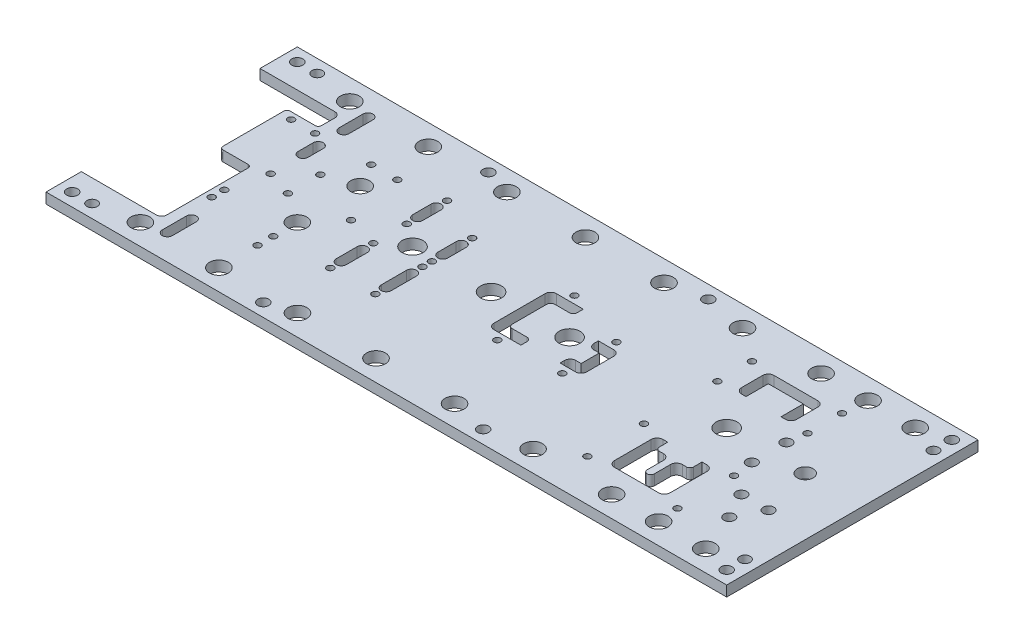
from build123d import *

# Parameters (mm, degrees)
SKETCH1_W                      = 650
SKETCH1_H                      = 240
BOSS_EXTRUDE1_DEPTH            = 10
CUT_EXTRUDE1_REACH             = 348.591
SKETCH2_R                      = 9
SKETCH2_R_2                    = 10
M6_CLEARANCE_HOLE1_D           = 6.4
M6_CLEARANCE_HOLE1_CSINK_D     = 6.45
M6_CLEARANCE_HOLE1_CSINK_ANGLE = 90
CUT_EXTRUDE2_REACH             = 348.591
FILLET1_R                      = 3
CUT_EXTRUDE3_REACH             = 348.591
SKETCH12_R                     = 5.113641914
SKETCH12_R_2                   = 7.613641914
CUT_EXTRUDE4_REACH             = 348.591
CUT_EXTRUDE5_REACH             = 348.591
CUT_EXTRUDE6_REACH             = 348.591
M10_CLEARANCE_HOLE1_D          = 10.5
F_10_0MM_DOWEL_HOLE1_D         = 10


with BuildPart() as part:
    # Sketch1 → Boss-Extrude1 (new body)
    with BuildSketch(Plane(origin=(0, 0, 0), x_dir=(1, 0, 0), z_dir=(0, 1, 0))):
        Rectangle(SKETCH1_W, SKETCH1_H)
    extrude(amount=-BOSS_EXTRUDE1_DEPTH)

    # Sketch2 → Cut-Extrude1 (cut, up to next)
    with BuildSketch(Plane.XZ.offset(10), mode=Mode.PRIVATE) as cut_extrude1_sk1:
        with Locations((-254.87, -100)):
            Circle(SKETCH2_R)
    cut_extrude1_tool1 = extrude(cut_extrude1_sk1.sketch, amount=-CUT_EXTRUDE1_REACH, mode=Mode.PRIVATE) & part.part
    # Sketch2 → Cut-Extrude1 (cut, up to next)
    with BuildSketch(Plane.XZ.offset(10), mode=Mode.PRIVATE) as cut_extrude1_sk2:
        with Locations((285, -100)):
            Circle(SKETCH2_R)
    cut_extrude1_tool2 = extrude(cut_extrude1_sk2.sketch, amount=-CUT_EXTRUDE1_REACH, mode=Mode.PRIVATE) & part.part
    # Sketch2 → Cut-Extrude1 (cut, up to next)
    with BuildSketch(Plane.XZ.offset(10), mode=Mode.PRIVATE) as cut_extrude1_sk3:
        with Locations((120.13, 100)):
            Circle(SKETCH2_R)
    cut_extrude1_tool3 = extrude(cut_extrude1_sk3.sketch, amount=-CUT_EXTRUDE1_REACH, mode=Mode.PRIVATE) & part.part
    # Sketch2 → Cut-Extrude1 (cut, up to next)
    with BuildSketch(Plane.XZ.offset(10), mode=Mode.PRIVATE) as cut_extrude1_sk4:
        with Locations((120.13, -100)):
            Circle(SKETCH2_R)
    cut_extrude1_tool4 = extrude(cut_extrude1_sk4.sketch, amount=-CUT_EXTRUDE1_REACH, mode=Mode.PRIVATE) & part.part
    # Sketch2 → Cut-Extrude1 (cut, up to next)
    with BuildSketch(Plane.XZ.offset(10), mode=Mode.PRIVATE) as cut_extrude1_sk5:
        with Locations((45.13, 100)):
            Circle(SKETCH2_R)
    cut_extrude1_tool5 = extrude(cut_extrude1_sk5.sketch, amount=-CUT_EXTRUDE1_REACH, mode=Mode.PRIVATE) & part.part
    # Sketch2 → Cut-Extrude1 (cut, up to next)
    with BuildSketch(Plane.XZ.offset(10), mode=Mode.PRIVATE) as cut_extrude1_sk6:
        with Locations((240, 100)):
            Circle(SKETCH2_R)
    cut_extrude1_tool6 = extrude(cut_extrude1_sk6.sketch, amount=-CUT_EXTRUDE1_REACH, mode=Mode.PRIVATE) & part.part
    # Sketch2 → Cut-Extrude1 (cut, up to next)
    with BuildSketch(Plane.XZ.offset(10), mode=Mode.PRIVATE) as cut_extrude1_sk7:
        with Locations((240, -100)):
            Circle(SKETCH2_R)
    cut_extrude1_tool7 = extrude(cut_extrude1_sk7.sketch, amount=-CUT_EXTRUDE1_REACH, mode=Mode.PRIVATE) & part.part
    # Sketch2 → Cut-Extrude1 (cut, up to next)
    with BuildSketch(Plane.XZ.offset(10), mode=Mode.PRIVATE) as cut_extrude1_sk8:
        with Locations((195.13, -100)):
            Circle(SKETCH2_R)
    cut_extrude1_tool8 = extrude(cut_extrude1_sk8.sketch, amount=-CUT_EXTRUDE1_REACH, mode=Mode.PRIVATE) & part.part
    # Sketch2 → Cut-Extrude1 (cut, up to next)
    with BuildSketch(Plane.XZ.offset(10), mode=Mode.PRIVATE) as cut_extrude1_sk9:
        with Locations((285, 100)):
            Circle(SKETCH2_R)
    cut_extrude1_tool9 = extrude(cut_extrude1_sk9.sketch, amount=-CUT_EXTRUDE1_REACH, mode=Mode.PRIVATE) & part.part
    # Sketch2 → Cut-Extrude1 (cut, up to next)
    with BuildSketch(Plane.XZ.offset(10), mode=Mode.PRIVATE) as cut_extrude1_sk10:
        with Locations((-104.87, -100)):
            Circle(SKETCH2_R)
    cut_extrude1_tool10 = extrude(cut_extrude1_sk10.sketch, amount=-CUT_EXTRUDE1_REACH, mode=Mode.PRIVATE) & part.part
    # Sketch2 → Cut-Extrude1 (cut, up to next)
    with BuildSketch(Plane.XZ.offset(10), mode=Mode.PRIVATE) as cut_extrude1_sk11:
        with Locations((-179.87, 100)):
            Circle(SKETCH2_R)
    cut_extrude1_tool11 = extrude(cut_extrude1_sk11.sketch, amount=-CUT_EXTRUDE1_REACH, mode=Mode.PRIVATE) & part.part
    # Sketch2 → Cut-Extrude1 (cut, up to next)
    with BuildSketch(Plane.XZ.offset(10), mode=Mode.PRIVATE) as cut_extrude1_sk12:
        with Locations((-179.87, -100)):
            Circle(SKETCH2_R)
    cut_extrude1_tool12 = extrude(cut_extrude1_sk12.sketch, amount=-CUT_EXTRUDE1_REACH, mode=Mode.PRIVATE) & part.part
    # Sketch2 → Cut-Extrude1 (cut, up to next)
    with BuildSketch(Plane.XZ.offset(10), mode=Mode.PRIVATE) as cut_extrude1_sk13:
        with Locations((45.13, -100)):
            Circle(SKETCH2_R)
    cut_extrude1_tool13 = extrude(cut_extrude1_sk13.sketch, amount=-CUT_EXTRUDE1_REACH, mode=Mode.PRIVATE) & part.part
    # Sketch2 → Cut-Extrude1 (cut, up to next)
    with BuildSketch(Plane.XZ.offset(10), mode=Mode.PRIVATE) as cut_extrude1_sk14:
        with Locations((-29.87, 100)):
            Circle(SKETCH2_R)
    cut_extrude1_tool14 = extrude(cut_extrude1_sk14.sketch, amount=-CUT_EXTRUDE1_REACH, mode=Mode.PRIVATE) & part.part
    # Sketch2 → Cut-Extrude1 (cut, up to next)
    with BuildSketch(Plane.XZ.offset(10), mode=Mode.PRIVATE) as cut_extrude1_sk15:
        with Locations((-29.87, -100)):
            Circle(SKETCH2_R)
    cut_extrude1_tool15 = extrude(cut_extrude1_sk15.sketch, amount=-CUT_EXTRUDE1_REACH, mode=Mode.PRIVATE) & part.part
    # Sketch2 → Cut-Extrude1 (cut, up to next)
    with BuildSketch(Plane.XZ.offset(10), mode=Mode.PRIVATE) as cut_extrude1_sk16:
        with Locations((-104.87, 100)):
            Circle(SKETCH2_R)
    cut_extrude1_tool16 = extrude(cut_extrude1_sk16.sketch, amount=-CUT_EXTRUDE1_REACH, mode=Mode.PRIVATE) & part.part
    # Sketch2 → Cut-Extrude1 (cut, up to next)
    with BuildSketch(Plane.XZ.offset(10), mode=Mode.PRIVATE) as cut_extrude1_sk17:
        with Locations((195.13, 100)):
            Circle(SKETCH2_R)
    cut_extrude1_tool17 = extrude(cut_extrude1_sk17.sketch, amount=-CUT_EXTRUDE1_REACH, mode=Mode.PRIVATE) & part.part
    # Sketch2 → Cut-Extrude1 (cut, up to next)
    with BuildSketch(Plane.XZ.offset(10), mode=Mode.PRIVATE) as cut_extrude1_sk18:
        with Locations((-254.87, 100)):
            Circle(SKETCH2_R)
    cut_extrude1_tool18 = extrude(cut_extrude1_sk18.sketch, amount=-CUT_EXTRUDE1_REACH, mode=Mode.PRIVATE) & part.part
    # Sketch2 → Cut-Extrude1 (cut, up to next)
    with BuildSketch(Plane.XZ.offset(10), mode=Mode.PRIVATE) as cut_extrude1_sk19:
        with Locations((195.13, -9.86)):
            Circle(SKETCH2_R_2)
    cut_extrude1_tool19 = extrude(cut_extrude1_sk19.sketch, amount=-CUT_EXTRUDE1_REACH, mode=Mode.PRIVATE) & part.part
    # Sketch2 → Cut-Extrude1 (cut, up to next)
    with BuildSketch(Plane.XZ.offset(10), mode=Mode.PRIVATE) as cut_extrude1_sk20:
        with Locations((45.13, -9.86)):
            Circle(SKETCH2_R_2)
    cut_extrude1_tool20 = extrude(cut_extrude1_sk20.sketch, amount=-CUT_EXTRUDE1_REACH, mode=Mode.PRIVATE) & part.part
    # Sketch2 → Cut-Extrude1 (cut, up to next)
    with BuildSketch(Plane.XZ.offset(10), mode=Mode.PRIVATE) as cut_extrude1_sk21:
        with Locations((-29.87, -9.86)):
            Circle(SKETCH2_R_2)
    cut_extrude1_tool21 = extrude(cut_extrude1_sk21.sketch, amount=-CUT_EXTRUDE1_REACH, mode=Mode.PRIVATE) & part.part
    # Sketch2 → Cut-Extrude1 (cut, up to next)
    with BuildSketch(Plane.XZ.offset(10), mode=Mode.PRIVATE) as cut_extrude1_sk22:
        with Locations((-104.87, -9.86)):
            Circle(SKETCH2_R_2)
    cut_extrude1_tool22 = extrude(cut_extrude1_sk22.sketch, amount=-CUT_EXTRUDE1_REACH, mode=Mode.PRIVATE) & part.part
    # Sketch2 → Cut-Extrude1 (cut, up to next)
    with BuildSketch(Plane.XZ.offset(10), mode=Mode.PRIVATE) as cut_extrude1_sk23:
        with Locations((-179.87, 25.14)):
            Circle(SKETCH2_R)
    cut_extrude1_tool23 = extrude(cut_extrude1_sk23.sketch, amount=-CUT_EXTRUDE1_REACH, mode=Mode.PRIVATE) & part.part
    # Sketch2 → Cut-Extrude1 (cut, up to next)
    with BuildSketch(Plane.XZ.offset(10), mode=Mode.PRIVATE) as cut_extrude1_sk24:
        with Locations((-179.87, -34.86)):
            Circle(SKETCH2_R)
    cut_extrude1_tool24 = extrude(cut_extrude1_sk24.sketch, amount=-CUT_EXTRUDE1_REACH, mode=Mode.PRIVATE) & part.part
    add(cut_extrude1_tool1.solids().sort_by_distance((-254.87, -10, -100))[0], mode=Mode.SUBTRACT)
    add(cut_extrude1_tool2.solids().sort_by_distance((285, -10, -100))[0], mode=Mode.SUBTRACT)
    add(cut_extrude1_tool3.solids().sort_by_distance((120.13, -10, 100))[0], mode=Mode.SUBTRACT)
    add(cut_extrude1_tool4.solids().sort_by_distance((120.13, -10, -100))[0], mode=Mode.SUBTRACT)
    add(cut_extrude1_tool5.solids().sort_by_distance((45.13, -10, 100))[0], mode=Mode.SUBTRACT)
    add(cut_extrude1_tool6.solids().sort_by_distance((240, -10, 100))[0], mode=Mode.SUBTRACT)
    add(cut_extrude1_tool7.solids().sort_by_distance((240, -10, -100))[0], mode=Mode.SUBTRACT)
    add(cut_extrude1_tool8.solids().sort_by_distance((195.13, -10, -100))[0], mode=Mode.SUBTRACT)
    add(cut_extrude1_tool9.solids().sort_by_distance((285, -10, 100))[0], mode=Mode.SUBTRACT)
    add(cut_extrude1_tool10.solids().sort_by_distance((-104.87, -10, -100))[0], mode=Mode.SUBTRACT)
    add(cut_extrude1_tool11.solids().sort_by_distance((-179.87, -10, 100))[0], mode=Mode.SUBTRACT)
    add(cut_extrude1_tool12.solids().sort_by_distance((-179.87, -10, -100))[0], mode=Mode.SUBTRACT)
    add(cut_extrude1_tool13.solids().sort_by_distance((45.13, -10, -100))[0], mode=Mode.SUBTRACT)
    add(cut_extrude1_tool14.solids().sort_by_distance((-29.87, -10, 100))[0], mode=Mode.SUBTRACT)
    add(cut_extrude1_tool15.solids().sort_by_distance((-29.87, -10, -100))[0], mode=Mode.SUBTRACT)
    add(cut_extrude1_tool16.solids().sort_by_distance((-104.87, -10, 100))[0], mode=Mode.SUBTRACT)
    add(cut_extrude1_tool17.solids().sort_by_distance((195.13, -10, 100))[0], mode=Mode.SUBTRACT)
    add(cut_extrude1_tool18.solids().sort_by_distance((-254.87, -10, 100))[0], mode=Mode.SUBTRACT)
    add(cut_extrude1_tool19.solids().sort_by_distance((195.13, -10, -9.86))[0], mode=Mode.SUBTRACT)
    add(cut_extrude1_tool20.solids().sort_by_distance((45.13, -10, -9.86))[0], mode=Mode.SUBTRACT)
    add(cut_extrude1_tool21.solids().sort_by_distance((-29.87, -10, -9.86))[0], mode=Mode.SUBTRACT)
    add(cut_extrude1_tool22.solids().sort_by_distance((-104.87, -10, -9.86))[0], mode=Mode.SUBTRACT)
    add(cut_extrude1_tool23.solids().sort_by_distance((-179.87, -10, 25.14))[0], mode=Mode.SUBTRACT)
    add(cut_extrude1_tool24.solids().sort_by_distance((-179.87, -10, -34.86))[0], mode=Mode.SUBTRACT)

    # M6 Clearance Hole1 (through all)
    with Locations(Plane(origin=(0, -10, 0), x_dir=(-1, 0, 0), z_dir=(0, -1, 0))):
        with Locations((-238.13, -26.14), (-152.13, -26.14), (-152.13, -80.14), (-238.13, -80.14), (-238.13, 77), (-152.13, 77), (-152.13, 44), (-238.13, 44), (-71.5, -23.486173195), (-71.5, 28.206173195), (-12.94, -26.986173195), (-12.94, 46.706173195), (83.37, 45.36), (83.37, 6.86), (126.37, 25.86), (126.37, 64.36), (83.37, -2.14), (126.37, -6.14), (126.37, -47.14), (83.37, -47.14), (156.12, 2.36), (208.37, -5.64), (208.37, 25.36), (192.37, 57.86), (167.37, 57.86), (179.87, -48.14), (179.87, -63.14), (241.62, -33.14), (241.62, -45.14), (232.87, 2.36), (267.87, 56.92), (245.000667118, 56.92)):
            CounterSinkHole(M6_CLEARANCE_HOLE1_D / 2, M6_CLEARANCE_HOLE1_CSINK_D / 2, counter_sink_angle=M6_CLEARANCE_HOLE1_CSINK_ANGLE)

    # Sketch8 → Cut-Extrude2 (cut, up to next)
    with BuildSketch(Plane(origin=(0, 0, 0), x_dir=(1, 0, 0), z_dir=(0, 1, 0)), mode=Mode.PRIVATE) as cut_extrude2_sk1:
        with BuildLine():
            Line((-325, -86.262387825), (-253.37, -86.262387825))
            ThreePointArc((-253.37, -86.262387825), (-249.834466094, -84.797921731), (-248.37, -81.262387825))
            Line((-248.37, -81.262387825), (-248.37, -3.64))
            ThreePointArc((-248.37, -3.64), (-249.248679656, -1.518679656), (-251.37, -0.64))
            Line((-251.37, -0.64), (-278.37, -0.64))
            Line((-278.37, -0.64), (-278.37, 63.48))
            Line((-278.37, 63.48), (-248.37, 63.48))
            Line((-248.37, 63.48), (-248.37, 79.36))
            ThreePointArc((-248.37, 79.36), (-249.834466094, 82.895533906), (-253.37, 84.36))
            Line((-253.37, 84.36), (-325, 84.36))
            Line((-325, 84.36), (-325, -86.262387825))
        make_face()
    cut_extrude2_tool1 = extrude(cut_extrude2_sk1.sketch, amount=-CUT_EXTRUDE2_REACH, mode=Mode.PRIVATE) & part.part
    add(cut_extrude2_tool1.solids().sort_by_distance((-290.753811, 0, 6.541566))[0], mode=Mode.SUBTRACT)

    # Fillet1
    fillet1_edges = [part.edges().sort_by_distance(p)[0] for p in [
        (-248.37, -5, -63.48),
        (-278.37, -5, -63.48),
        (-278.37, -5, 0.64),
    ]]
    fillet(fillet1_edges, radius=FILLET1_R)

    # Sketch12 → Cut-Extrude3 (cut, up to next)
    with BuildSketch(Plane.XZ.offset(10), mode=Mode.PRIVATE) as cut_extrude3_sk1:
        with Locations((270.13, 62.64)):
            Circle(SKETCH12_R)
    cut_extrude3_tool1 = extrude(cut_extrude3_sk1.sketch, amount=-CUT_EXTRUDE3_REACH, mode=Mode.PRIVATE) & part.part
    # Sketch12 → Cut-Extrude3 (cut, up to next)
    with BuildSketch(Plane.XZ.offset(10), mode=Mode.PRIVATE) as cut_extrude3_sk2:
        with Locations((283.13, 38.14)):
            Circle(SKETCH12_R)
    cut_extrude3_tool2 = extrude(cut_extrude3_sk2.sketch, amount=-CUT_EXTRUDE3_REACH, mode=Mode.PRIVATE) & part.part
    # Sketch12 → Cut-Extrude3 (cut, up to next)
    with BuildSketch(Plane.XZ.offset(10), mode=Mode.PRIVATE) as cut_extrude3_sk3:
        with Locations((257.13, 38.14)):
            Circle(SKETCH12_R)
    cut_extrude3_tool3 = extrude(cut_extrude3_sk3.sketch, amount=-CUT_EXTRUDE3_REACH, mode=Mode.PRIVATE) & part.part
    # Sketch12 → Cut-Extrude3 (cut, up to next)
    with BuildSketch(Plane.XZ.offset(10), mode=Mode.PRIVATE) as cut_extrude3_sk4:
        with Locations((270.13, -9.86)):
            Circle(SKETCH12_R_2)
    cut_extrude3_tool4 = extrude(cut_extrude3_sk4.sketch, amount=-CUT_EXTRUDE3_REACH, mode=Mode.PRIVATE) & part.part
    # Sketch12 → Cut-Extrude3 (cut, up to next)
    with BuildSketch(Plane.XZ.offset(10), mode=Mode.PRIVATE) as cut_extrude3_sk5:
        with Locations((235.63, -26.36)):
            Circle(SKETCH12_R)
    cut_extrude3_tool5 = extrude(cut_extrude3_sk5.sketch, amount=-CUT_EXTRUDE3_REACH, mode=Mode.PRIVATE) & part.part
    # Sketch12 → Cut-Extrude3 (cut, up to next)
    with BuildSketch(Plane.XZ.offset(10), mode=Mode.PRIVATE) as cut_extrude3_sk6:
        with Locations((235.63, 6.64)):
            Circle(SKETCH12_R)
    cut_extrude3_tool6 = extrude(cut_extrude3_sk6.sketch, amount=-CUT_EXTRUDE3_REACH, mode=Mode.PRIVATE) & part.part
    # Sketch12 → Cut-Extrude3 (cut, up to next)
    with BuildSketch(Plane.XZ.offset(10), mode=Mode.PRIVATE) as cut_extrude3_sk7:
        with BuildLine():
            Line((211.837653611, -45.067653611), (211.837653611, -66.347653611))
            Line((211.837653611, -66.347653611), (178.422346389, -66.347653611))
            Line((178.422346389, -66.347653611), (178.422346389, -45.067653611))
            Line((178.422346389, -45.067653611), (174.13, -45.067653611))
            ThreePointArc((174.13, -45.067653611), (170.38774598, -46.61774598), (168.837653611, -50.36))
            Line((168.837653611, -50.36), (168.837653611, -70.64))
            ThreePointArc((168.837653611, -70.64), (170.38774598, -74.38225402), (174.13, -75.932346389))
            Line((174.13, -75.932346389), (195.13, -75.932346389))
            Line((195.13, -75.932346389), (216.13, -75.932346389))
            ThreePointArc((216.13, -75.932346389), (219.87225402, -74.38225402), (221.422346389, -70.64))
            Line((221.422346389, -70.64), (221.422346389, -50.36))
            ThreePointArc((221.422346389, -50.36), (219.87225402, -46.61774598), (216.13, -45.067653611))
            Line((216.13, -45.067653611), (211.837653611, -45.067653611))
        make_face()
    cut_extrude3_tool7 = extrude(cut_extrude3_sk7.sketch, amount=-CUT_EXTRUDE3_REACH, mode=Mode.PRIVATE) & part.part
    # Sketch12 → Cut-Extrude3 (cut, up to next)
    with BuildSketch(Plane.XZ.offset(10), mode=Mode.PRIVATE) as cut_extrude3_sk8:
        with BuildLine():
            Line((211.516358086, 30.026358086), (216.13, 30.026358086))
            ThreePointArc((216.13, 30.026358086), (220.099444264, 31.670555736), (221.743641914, 35.64))
            Line((221.743641914, 35.64), (221.743641914, 53.14))
            Line((221.743641914, 53.14), (221.743641914, 70.64))
            ThreePointArc((221.743641914, 70.64), (220.099444264, 74.609444264), (216.13, 76.253641914))
            Line((216.13, 76.253641914), (174.13, 76.253641914))
            ThreePointArc((174.13, 76.253641914), (170.160555736, 74.609444264), (168.516358086, 70.64))
            Line((168.516358086, 70.64), (168.516358086, 35.64))
            ThreePointArc((168.516358086, 35.64), (170.160555736, 31.670555736), (174.13, 30.026358086))
            Line((174.13, 30.026358086), (178.743641914, 30.026358086))
            Line((178.743641914, 30.026358086), (178.743641914, 38.14))
            ThreePointArc((178.743641914, 38.14), (179.735483234, 40.534516766), (182.13, 41.526358086))
            Line((182.13, 41.526358086), (186.13, 41.526358086))
            ThreePointArc((186.13, 41.526358086), (190.099444264, 43.170555736), (191.743641914, 47.14))
            Line((191.743641914, 47.14), (191.743641914, 62.64))
            ThreePointArc((191.743641914, 62.64), (195.13, 66.026358086), (198.516358086, 62.64))
            Line((198.516358086, 62.64), (198.516358086, 47.14))
            ThreePointArc((198.516358086, 47.14), (200.160555736, 43.170555736), (204.13, 41.526358086))
            Line((204.13, 41.526358086), (208.13, 41.526358086))
            ThreePointArc((208.13, 41.526358086), (210.524516766, 40.534516766), (211.516358086, 38.14))
            Line((211.516358086, 38.14), (211.516358086, 30.026358086))
        make_face()
    cut_extrude3_tool8 = extrude(cut_extrude3_sk8.sketch, amount=-CUT_EXTRUDE3_REACH, mode=Mode.PRIVATE) & part.part
    add(cut_extrude3_tool1.solids().sort_by_distance((270.13, -10, 62.64))[0], mode=Mode.SUBTRACT)
    add(cut_extrude3_tool2.solids().sort_by_distance((283.13, -10, 38.14))[0], mode=Mode.SUBTRACT)
    add(cut_extrude3_tool3.solids().sort_by_distance((257.13, -10, 38.14))[0], mode=Mode.SUBTRACT)
    add(cut_extrude3_tool4.solids().sort_by_distance((270.13, -10, -9.86))[0], mode=Mode.SUBTRACT)
    add(cut_extrude3_tool5.solids().sort_by_distance((235.63, -10, -26.36))[0], mode=Mode.SUBTRACT)
    add(cut_extrude3_tool6.solids().sort_by_distance((235.63, -10, 6.64))[0], mode=Mode.SUBTRACT)
    add(cut_extrude3_tool7.solids().sort_by_distance((205.63, -10, -75.32261))[0], mode=Mode.SUBTRACT)
    add(cut_extrude3_tool8.solids().sort_by_distance((206.13, -10, 42.231348))[0], mode=Mode.SUBTRACT)

    # Sketch13 → Cut-Extrude4 (cut, up to next)
    with BuildSketch(Plane.XZ.offset(10), mode=Mode.PRIVATE) as cut_extrude4_sk1:
        with BuildLine():
            Line((61.837653611, 15.932346389), (61.837653611, 11.64))
            ThreePointArc((61.837653611, 11.64), (63.38774598, 7.89774598), (67.13, 6.347653611))
            Line((67.13, 6.347653611), (72.337653611, 6.347653611))
            Line((72.337653611, 6.347653611), (72.337653611, -11.067653611))
            Line((72.337653611, -11.067653611), (67.13, -11.067653611))
            ThreePointArc((67.13, -11.067653611), (63.38774598, -12.61774598), (61.837653611, -16.36))
            Line((61.837653611, -16.36), (61.837653611, -20.652346389))
            Line((61.837653611, -20.652346389), (76.63, -20.652346389))
            ThreePointArc((76.63, -20.652346389), (80.37225402, -19.10225402), (81.922346389, -15.36))
            Line((81.922346389, -15.36), (81.922346389, -2.36))
            Line((81.922346389, -2.36), (81.922346389, 10.64))
            ThreePointArc((81.922346389, 10.64), (80.37225402, 14.38225402), (76.63, 15.932346389))
            Line((76.63, 15.932346389), (61.837653611, 15.932346389))
        make_face()
    cut_extrude4_tool1 = extrude(cut_extrude4_sk1.sketch, amount=-CUT_EXTRUDE4_REACH, mode=Mode.PRIVATE) & part.part
    # Sketch13 → Cut-Extrude4 (cut, up to next)
    with BuildSketch(Plane.XZ.offset(10), mode=Mode.PRIVATE) as cut_extrude4_sk2:
        with BuildLine():
            Line((2.63, -39.652346389), (28.422346389, -39.652346389))
            Line((28.422346389, -39.652346389), (28.422346389, -33.86))
            ThreePointArc((28.422346389, -33.86), (27.311593849, -31.178406151), (24.63, -30.067653611))
            Line((24.63, -30.067653611), (10.63, -30.067653611))
            ThreePointArc((10.63, -30.067653611), (8.00829299, -28.98170701), (6.922346389, -26.36))
            Line((6.922346389, -26.36), (6.922346389, 6.64))
            ThreePointArc((6.922346389, 6.64), (8.00829299, 9.26170701), (10.63, 10.347653611))
            Line((10.63, 10.347653611), (24.63, 10.347653611))
            ThreePointArc((24.63, 10.347653611), (27.311593849, 11.458406151), (28.422346389, 14.14))
            Line((28.422346389, 14.14), (28.422346389, 19.932346389))
            Line((28.422346389, 19.932346389), (2.63, 19.932346389))
            ThreePointArc((2.63, 19.932346389), (-1.11225402, 18.38225402), (-2.662346389, 14.64))
            Line((-2.662346389, 14.64), (-2.662346389, -13.23))
            Line((-2.662346389, -13.23), (-2.662346389, -34.36))
            ThreePointArc((-2.662346389, -34.36), (-1.11225402, -38.10225402), (2.63, -39.652346389))
        make_face()
    cut_extrude4_tool2 = extrude(cut_extrude4_sk2.sketch, amount=-CUT_EXTRUDE4_REACH, mode=Mode.PRIVATE) & part.part
    add(cut_extrude4_tool1.solids().sort_by_distance((73.54007, -10, -2.36))[0], mode=Mode.SUBTRACT)
    add(cut_extrude4_tool2.solids().sort_by_distance((-0.637039, -10, -37.627039))[0], mode=Mode.SUBTRACT)

    # Sketch14 → Cut-Extrude5 (cut, up to next)
    with BuildSketch(Plane.XZ.offset(10), mode=Mode.PRIVATE) as cut_extrude5_sk1:
        with BuildLine():
            Line((-88.162346389, -17.31), (-88.162346389, -34.91))
            ThreePointArc((-88.162346389, -34.91), (-83.37, -39.702346389), (-78.577653611, -34.91))
            Line((-78.577653611, -34.91), (-78.577653611, -26.11))
            Line((-78.577653611, -26.11), (-78.577653611, -17.31))
            ThreePointArc((-78.577653611, -17.31), (-83.37, -12.517653611), (-88.162346389, -17.31))
        make_face()
    cut_extrude5_tool1 = extrude(cut_extrude5_sk1.sketch, amount=-CUT_EXTRUDE5_REACH, mode=Mode.PRIVATE) & part.part
    # Sketch14 → Cut-Extrude5 (cut, up to next)
    with BuildSketch(Plane.XZ.offset(10), mode=Mode.PRIVATE) as cut_extrude5_sk2:
        with BuildLine():
            Line((-78.577653611, 12.59), (-78.577653611, 24.64))
            Line((-78.577653611, 24.64), (-78.577653611, 36.69))
            ThreePointArc((-78.577653611, 36.69), (-83.37, 41.482346389), (-88.162346389, 36.69))
            Line((-88.162346389, 36.69), (-88.162346389, 12.59))
            ThreePointArc((-88.162346389, 12.59), (-83.37, 7.797653611), (-78.577653611, 12.59))
        make_face()
    cut_extrude5_tool2 = extrude(cut_extrude5_sk2.sketch, amount=-CUT_EXTRUDE5_REACH, mode=Mode.PRIVATE) & part.part
    # Sketch14 → Cut-Extrude5 (cut, up to next)
    with BuildSketch(Plane.XZ.offset(10), mode=Mode.PRIVATE) as cut_extrude5_sk3:
        with BuildLine():
            Line((-131.232166649, 36.69), (-131.232166649, 16.59))
            ThreePointArc((-131.232166649, 16.59), (-126.37, 11.727833351), (-121.507833351, 16.59))
            Line((-121.507833351, 16.59), (-121.507833351, 26.64))
            Line((-121.507833351, 26.64), (-121.507833351, 36.69))
            ThreePointArc((-121.507833351, 36.69), (-126.37, 41.552166649), (-131.232166649, 36.69))
        make_face()
    cut_extrude5_tool3 = extrude(cut_extrude5_sk3.sketch, amount=-CUT_EXTRUDE5_REACH, mode=Mode.PRIVATE) & part.part
    # Sketch14 → Cut-Extrude5 (cut, up to next)
    with BuildSketch(Plane.XZ.offset(10), mode=Mode.PRIVATE) as cut_extrude5_sk4:
        with BuildLine():
            Line((-131.162346389, -36.31), (-131.162346389, -53.91))
            ThreePointArc((-131.162346389, -53.91), (-126.37, -58.702346389), (-121.577653611, -53.91))
            Line((-121.577653611, -53.91), (-121.577653611, -45.11))
            Line((-121.577653611, -45.11), (-121.577653611, -36.31))
            ThreePointArc((-121.577653611, -36.31), (-126.37, -31.517653611), (-131.162346389, -36.31))
        make_face()
    cut_extrude5_tool4 = extrude(cut_extrude5_sk4.sketch, amount=-CUT_EXTRUDE5_REACH, mode=Mode.PRIVATE) & part.part
    add(cut_extrude5_tool1.solids().sort_by_distance((-83.37, -10, -26.11))[0], mode=Mode.SUBTRACT)
    add(cut_extrude5_tool2.solids().sort_by_distance((-83.37, -10, 24.64))[0], mode=Mode.SUBTRACT)
    add(cut_extrude5_tool3.solids().sort_by_distance((-126.37, -10, 26.64))[0], mode=Mode.SUBTRACT)
    add(cut_extrude5_tool4.solids().sort_by_distance((-126.37, -10, -45.11))[0], mode=Mode.SUBTRACT)

    # Sketch15 → Cut-Extrude6 (cut, up to next)
    with BuildSketch(Plane.XZ.offset(10), mode=Mode.PRIVATE) as cut_extrude6_sk1:
        with BuildLine():
            Line((-228.577653611, -95.77), (-228.577653611, -84.32))
            Line((-228.577653611, -84.32), (-228.577653611, -72.87))
            ThreePointArc((-228.577653611, -72.87), (-233.37, -68.077653611), (-238.162346389, -72.87))
            Line((-238.162346389, -72.87), (-238.162346389, -95.77))
            ThreePointArc((-238.162346389, -95.77), (-233.37, -100.562346389), (-228.577653611, -95.77))
        make_face()
    cut_extrude6_tool1 = extrude(cut_extrude6_sk1.sketch, amount=-CUT_EXTRUDE6_REACH, mode=Mode.PRIVATE) & part.part
    # Sketch15 → Cut-Extrude6 (cut, up to next)
    with BuildSketch(Plane.XZ.offset(10), mode=Mode.PRIVATE) as cut_extrude6_sk2:
        with BuildLine():
            Line((-238.162346389, -33.86), (-238.162346389, -48.36))
            ThreePointArc((-238.162346389, -48.36), (-233.37, -53.152346389), (-228.577653611, -48.36))
            Line((-228.577653611, -48.36), (-228.577653611, -41.11))
            Line((-228.577653611, -41.11), (-228.577653611, -33.86))
            ThreePointArc((-228.577653611, -33.86), (-233.37, -29.067653611), (-238.162346389, -33.86))
        make_face()
    cut_extrude6_tool2 = extrude(cut_extrude6_sk2.sketch, amount=-CUT_EXTRUDE6_REACH, mode=Mode.PRIVATE) & part.part
    # Sketch15 → Cut-Extrude6 (cut, up to next)
    with BuildSketch(Plane.XZ.offset(10), mode=Mode.PRIVATE) as cut_extrude6_sk3:
        with BuildLine():
            Line((-238.162346389, 95.77), (-238.162346389, 72.87))
            ThreePointArc((-238.162346389, 72.87), (-233.37, 68.077653611), (-228.577653611, 72.87))
            Line((-228.577653611, 72.87), (-228.577653611, 84.32))
            Line((-228.577653611, 84.32), (-228.577653611, 95.77))
            ThreePointArc((-228.577653611, 95.77), (-233.37, 100.562346389), (-238.162346389, 95.77))
        make_face()
    cut_extrude6_tool3 = extrude(cut_extrude6_sk3.sketch, amount=-CUT_EXTRUDE6_REACH, mode=Mode.PRIVATE) & part.part
    add(cut_extrude6_tool1.solids().sort_by_distance((-233.37, -10, -84.32))[0], mode=Mode.SUBTRACT)
    add(cut_extrude6_tool2.solids().sort_by_distance((-233.37, -10, -41.11))[0], mode=Mode.SUBTRACT)
    add(cut_extrude6_tool3.solids().sort_by_distance((-233.37, -10, 84.32))[0], mode=Mode.SUBTRACT)

    # M10 Clearance Hole1 (through all)
    with Locations(Plane(origin=(0, -10, 0), x_dir=(-1, 0, 0), z_dir=(0, -1, 0))):
        with Locations((-312.5, 107.5), (-312.5, -107.5), (-80, 107.5), (130, 107.5), (312.5, 107.5), (312.5, -107.5), (130, -107.5), (-80, -107.5)):
            Hole(M10_CLEARANCE_HOLE1_D / 2)

    # Ø10.0mm Dowel Hole1 (through all)
    with Locations(Plane(origin=(0, -10, 0), x_dir=(-1, 0, 0), z_dir=(0, -1, 0))):
        with Locations((-312.5, 90), (-312.5, -90), (293.5, -107.5), (293.5, 107.5)):
            Hole(F_10_0MM_DOWEL_HOLE1_D / 2)


solid = part.part
